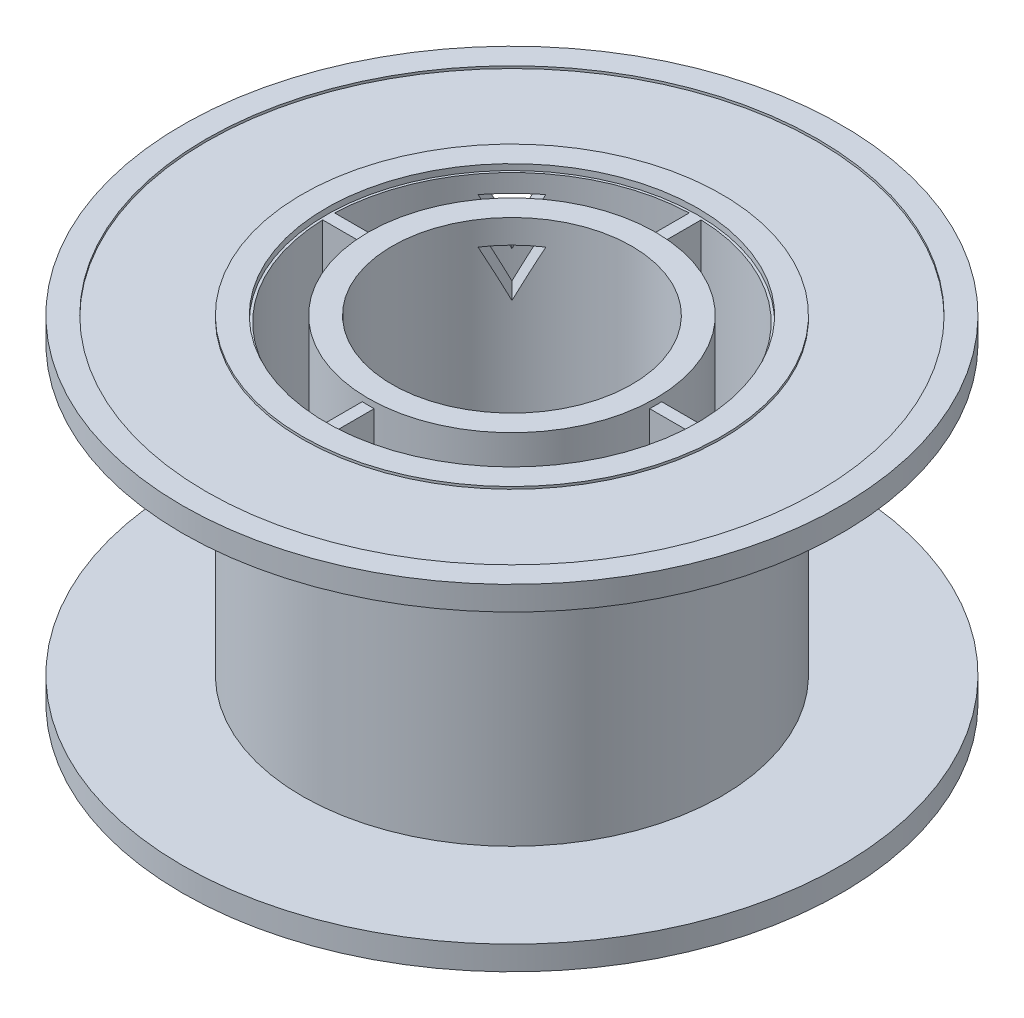
from build123d import *

# Parameters (mm, degrees)
SKETCH_1_R               = 27.5
EXTRUDE_1_DEPTH          = 2
SKETCH_2_R               = 17.5
EXTRUDE_4_DEPTH          = 28
EXTRUDE_START            = -2
SKETCH_4_R               = 27.5
EXTRUDE_5_DEPTH          = 2
SHELL_1_OUTLINE_R        = 15.5
SHELL_1_DEPTH            = 28
SKETCH_5_R               = 27.5
SKETCH_5_R_2             = 10
EXTRUDE_6_DEPTH          = 2
SKETCH_6_R               = 12
SKETCH_6_R_2             = 10
EXTRUDE_7_DEPTH          = 26
RIB_START                = -0.5
RIB_1_OUTLINE_W          = 7
RIB_1_OUTLINE_H          = 25.5
RIB_1_DEPTH              = 1
PATTERN_CIRCULAR_1_COUNT = 4
SKETCH_9_R               = 15.5
SKETCH_9_R_2             = 15.3
EXTRUDE_8_DEPTH          = 25.5
CUT_EXTRUDE_2_DEPTH      = 48.921811318
CUT_EXTRUDE_START        = -0.2
SKETCH_10_R              = 25.5
SKETCH_10_R_2            = 17.5
CUT_EXTRUDE_3_DEPTH      = 0.2


# Read off the part's stored shape, not the designer's step: 抽壳1, 筋1
with BuildPart() as part:
    # 草图1 → 凸台-拉伸1 (new body)
    with BuildSketch(Plane(origin=(0, 0, 0), x_dir=(1, 0, 0), z_dir=(0, 1, 0))):
        with Locations(Location((0, 0, 0), (0, 0, 270))):
            Circle(SKETCH_1_R)
    extrude(amount=EXTRUDE_1_DEPTH)

    # 草图2 → 凸台-拉伸4 (add)
    with BuildSketch(Plane.XZ):
        with Locations(Location((0, 0, 0), (0, 0, 270))):
            Circle(SKETCH_2_R)
    extrude(amount=-EXTRUDE_4_DEPTH)

    # 草图4 → 凸台-拉伸5 (add)
    with BuildSketch(Plane(origin=(0, 28, 0), x_dir=(1, 0, 0), z_dir=(0, 1, 0)).offset(EXTRUDE_START)):
        with Locations(Location((0, 0, 0), (0, 0, 270))):
            Circle(SKETCH_4_R)
    extrude(amount=EXTRUDE_5_DEPTH)

    # 抽壳1 outline → 抽壳1 (cut)
    with BuildSketch(Plane(origin=(0, 0, 0), x_dir=(1, 0, 0), z_dir=(0, 1, 0))):
        Circle(SHELL_1_OUTLINE_R)
    extrude(amount=SHELL_1_DEPTH, mode=Mode.SUBTRACT)

    # 草图5 → 凸台-拉伸6 (add)
    with BuildSketch(Plane.XZ):
        with Locations(Location((0, 0, 0), (0, 0, 90))):
            Circle(SKETCH_5_R)
        with Locations(Location((0, 0, 0), (0, 0, 270))):
            Circle(SKETCH_5_R_2, mode=Mode.SUBTRACT)
    extrude(amount=-EXTRUDE_6_DEPTH)

    # 草图6 → 凸台-拉伸7 (add)
    with BuildSketch(Plane(origin=(0, 2, 0), x_dir=(1, 0, 0), z_dir=(0, 1, 0))):
        with Locations(Location((0, 0, 0), (0, 0, 90))):
            Circle(SKETCH_6_R)
        with Locations(Location((0, 0, 0), (0, 0, 90))):
            Circle(SKETCH_6_R_2, mode=Mode.SUBTRACT)
    extrude(amount=EXTRUDE_7_DEPTH)

    # 筋1 outline → 筋1 (add)
    with BuildSketch(Plane.XY.offset(RIB_START)):
        with Locations((13.5, 14.75)):
            Rectangle(RIB_1_OUTLINE_W, RIB_1_OUTLINE_H)
    rib_1 = extrude(amount=RIB_1_DEPTH)

    # 阵列(圆周)1: 筋1 ×4 about axis
    pattern_circular_1_axis = Axis((0, 0, 0), (0, 1, 0))
    for i in range(1, PATTERN_CIRCULAR_1_COUNT):
        add(rib_1.rotate(pattern_circular_1_axis, i * 360 / PATTERN_CIRCULAR_1_COUNT))

    # 草图9 → 凸台-拉伸8 (add)
    with BuildSketch(Plane(origin=(0, 2, 0), x_dir=(1, 0, 0), z_dir=(0, 1, 0))):
        with Locations(Location((0, 0, 0), (0, 0, 90))):
            Circle(SKETCH_9_R)
        Circle(SKETCH_9_R_2, mode=Mode.SUBTRACT)
    extrude(amount=EXTRUDE_8_DEPTH)

    # 草图8 → 切除-拉伸2 (cut, through all)
    with BuildSketch(Plane(origin=(0, 0, 0), x_dir=(0, 1, 0), z_dir=(0.7071067811865488, 0, 0.7071067811865464))):
        Polygon((26, 2), (26, -2), (22, 0), align=None)
    cut_extrude_2 = extrude(amount=-CUT_EXTRUDE_2_DEPTH, mode=Mode.SUBTRACT)

    # 镜向2: 切除-拉伸2 across plane
    add(cut_extrude_2.mirror(Plane.ZX.offset(14)), mode=Mode.SUBTRACT)

    # 草图10 → 切除-拉伸3 (cut)
    with BuildSketch(Plane(origin=(0, 28, 0), x_dir=(1, 0, 0), z_dir=(0, 1, 0)).offset(CUT_EXTRUDE_START)):
        with Locations(Location((0, 0, 0), (0, 0, 270))):
            Circle(SKETCH_10_R)
        with Locations(Location((0, 0, 0), (0, 0, 128.437572131))):
            Circle(SKETCH_10_R_2, mode=Mode.SUBTRACT)
    cut_extrude_3 = extrude(amount=CUT_EXTRUDE_3_DEPTH, mode=Mode.SUBTRACT)

    # 镜向3: 切除-拉伸3 across plane
    add(cut_extrude_3.mirror(Plane.ZX.offset(14)), mode=Mode.SUBTRACT)


solid = part.part
